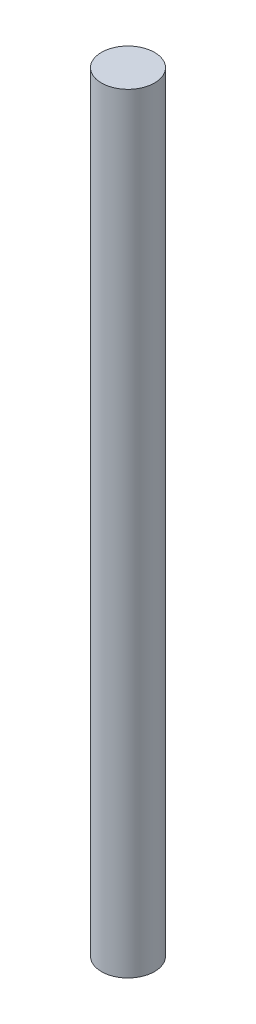
from build123d import *

# Parameters (mm, degrees)
SKETCH1_R           = 5
BOSS_EXTRUDE1_DEPTH = 145


with BuildPart() as part:
    # Sketch1 → Boss-Extrude1 (new body)
    with BuildSketch(Plane(origin=(0, 0, 0), x_dir=(1, 0, 0), z_dir=(0, 1, 0))):
        Circle(SKETCH1_R)
    extrude(amount=BOSS_EXTRUDE1_DEPTH)


solid = part.part
